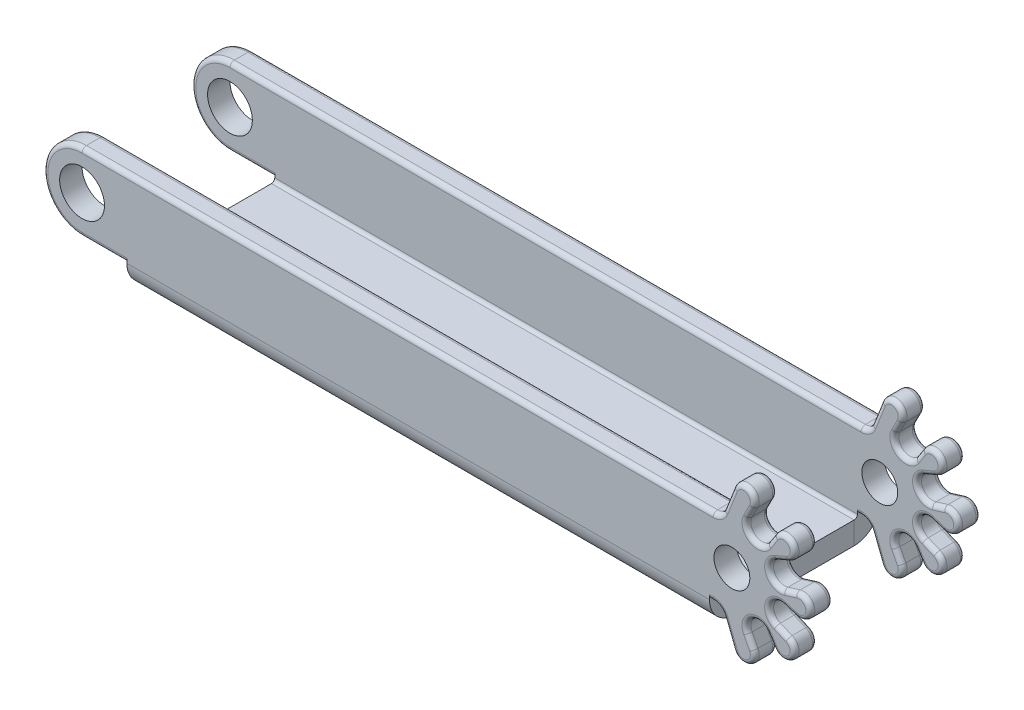
from build123d import *

# Parameters (mm, degrees)
SKETCH1_W                      = 130
SKETCH1_H                      = 38
BASE_FLANGE1_DEPTH             = 5
EDGE_FLANGE1_STRIP_W           = 21.4732
EDGE_FLANGE1_STRIP_H           = 5
EDGE_FLANGE1_STRIP_CUT_DEPTH   = 130
EDGE_FLANGE1_STRIP_2_W         = 21.4732
EDGE_FLANGE1_STRIP_2_H         = 5
EDGE_FLANGE1_STRIP_CUT_2_DEPTH = 130
EDGE_FLANGE1_DEPTH             = 130
EDGE_FLANGE1_BEND_DEPTH        = 130
SKETCH15_R                     = 5
BOSS_EXTRUDE1_DEPTH            = 5
BOSS_EXTRUDE2_DEPTH            = 5
SKETCH17_R                     = 4
CUT_EXTRUDE2_DEPTH             = 5
FILLET3_R                      = 2.5
FILLET4_R                      = 1


# Sheet-metal steps are written as plain solids
with BuildPart() as part:
    # Sketch1 → Base-Flange1 (new body)
    with BuildSketch(Plane(origin=(0, 0, 0), x_dir=(1, 0, 0), z_dir=(0, 1, 0))):
        Rectangle(SKETCH1_W, SKETCH1_H)
    extrude(amount=-BASE_FLANGE1_DEPTH)

    # Edge-Flange1 strip (across the edge) → Edge-Flange1 strip cut (cut)
    with BuildSketch(Plane(origin=(-65, 0, 19), x_dir=(0, 0, -1), z_dir=(1, 0, 0))):
        with Locations((-5, -2.5)):
            Rectangle(EDGE_FLANGE1_STRIP_W, EDGE_FLANGE1_STRIP_H)
    extrude(amount=EDGE_FLANGE1_STRIP_CUT_DEPTH, mode=Mode.SUBTRACT)

    # Edge-Flange1 strip 2 (across the edge) → Edge-Flange1 strip cut 2 (cut)
    with BuildSketch(Plane(origin=(65, 0, -19), x_dir=(0, 0, 1), z_dir=(-1, 0, 0))):
        with Locations((-5, -2.5)):
            Rectangle(EDGE_FLANGE1_STRIP_2_W, EDGE_FLANGE1_STRIP_2_H)
    extrude(amount=EDGE_FLANGE1_STRIP_CUT_2_DEPTH, mode=Mode.SUBTRACT)

    # Edge-Flange1 section (across the edge) → Edge-Flange1 (add)
    with BuildSketch(Plane(origin=(-65, 0, 19), x_dir=(0, 0, -1), z_dir=(1, 0, 0))):
        with BuildLine():
            Line((0, 0.7366), (0, 18))
            Line((0, 18), (5, 18))
            Line((5, 18), (5, 0.7366))
            ThreePointArc((5, 0.7366), (5.215745145, 0.215745145), (5.7366, 0))
            Line((5.7366, 0), (5.7366, -5))
            ThreePointArc((5.7366, -5), (1.680211239, -3.319788761), (0, 0.7366))
        make_face()
    extrude(amount=EDGE_FLANGE1_DEPTH)

    # Edge-Flange1 section 2 (across the edge) → Edge-Flange1 bend (add)
    with BuildSketch(Plane(origin=(65, 0, -19), x_dir=(0, 0, 1), z_dir=(-1, 0, 0))):
        with BuildLine():
            Line((0, 0.7366), (0, 18))
            Line((0, 18), (5, 18))
            Line((5, 18), (5, 0.7366))
            ThreePointArc((5, 0.7366), (5.215745145, 0.215745145), (5.7366, 0))
            Line((5.7366, 0), (5.7366, -5))
            ThreePointArc((5.7366, -5), (1.680211239, -3.319788761), (0, 0.7366))
        make_face()
    extrude(amount=EDGE_FLANGE1_BEND_DEPTH)

    # Sketch15 → Boss-Extrude1 (add)
    with BuildSketch(Plane.XY.offset(19)):
        with BuildLine():
            Line((-75, 18), (-65, 18))
            Line((-65, 18), (-65, 0.7366))
            Line((-65, 0.7366), (-75, 0.7366))
            ThreePointArc((-75, 0.7366), (-83.6317, 9.3683), (-75, 18))
        make_face()
        with Locations((-75, 9.3683)):
            Circle(SKETCH15_R, mode=Mode.SUBTRACT)
    boss_extrude1 = extrude(amount=-BOSS_EXTRUDE1_DEPTH)

    # Mirror3: Boss-Extrude1 across plane
    add(boss_extrude1.mirror(Plane.XY))

    # Sketch16 → Boss-Extrude2 (add)
    with BuildSketch(Plane.XY.offset(19)):
        with BuildLine():
            Line((65, 18), (67.5, 18))
            Line((67.5, 18), (70.278564416, 25.056379068))
            ThreePointArc((70.278564416, 25.056379068), (73.636399449, 26.417616992), (74.827213938, 22.995631363))
            Line((74.827213938, 22.995631363), (73.527508727, 20.472377076))
            ThreePointArc((73.527508727, 20.472377076), (74.5, 17.162528634), (77.85265847, 17.975250708))
            Line((77.85265847, 17.975250708), (79.388008177, 20.362455581))
            ThreePointArc((79.388008177, 20.362455581), (83.405777755, 20.61708317), (82.457340166, 16.704568156))
            Line((82.457340166, 16.704568156), (79.83979162, 15.607077637))
            ThreePointArc((79.83979162, 15.607077637), (78.457233587, 12.44648129), (81.547926657, 10.914015194))
            Line((81.547926657, 10.914015194), (84.258538482, 11.755816454))
            ThreePointArc((84.258538482, 11.755816454), (87.5, 9.3683), (84.258538482, 6.980783546))
            Line((84.258538482, 6.980783546), (81.547926657, 7.822584806))
            ThreePointArc((81.547926657, 7.822584806), (78.457233587, 6.29011871), (79.83979162, 3.129522363))
            Line((79.83979162, 3.129522363), (82.457340166, 2.032031844))
            ThreePointArc((82.457340166, 2.032031844), (83.405777755, -1.88048317), (79.388008177, -1.625855581))
            Line((79.388008177, -1.625855581), (77.85265847, 0.761349292))
            ThreePointArc((77.85265847, 0.761349292), (74.5, 1.574071366), (73.527508727, -1.735777076))
            Line((73.527508727, -1.735777076), (74.827213938, -4.259031363))
            ThreePointArc((74.827213938, -4.259031363), (73.636399449, -7.681016992), (70.278564416, -6.319779068))
            Line((70.278564416, -6.319779068), (67.5, 0.7366))
            Line((67.5, 0.7366), (65, 0.7366))
            Line((65, 0.7366), (65, 18))
        make_face()
    boss_extrude2 = extrude(amount=-BOSS_EXTRUDE2_DEPTH)

    # Sketch17 → Cut-Extrude2 (cut)
    with BuildSketch(Plane.XY.offset(19)):
        with Locations((70, 9.3683)):
            Circle(SKETCH17_R)
    cut_extrude2 = extrude(amount=-CUT_EXTRUDE2_DEPTH, mode=Mode.SUBTRACT)

    # Mirror5: Boss-Extrude2, Cut-Extrude2 across plane
    add(boss_extrude2.mirror(Plane.XY))
    add(cut_extrude2.mirror(Plane.XY), mode=Mode.SUBTRACT)

    # Fillet3
    fillet3_edges = [part.edges().sort_by_distance(p)[0] for p in [
        (67.5, 0.7366, 16.5),
        (67.5, 18, 16.5),
        (67.5, 18, -16.5),
        (67.5, 0.7366, -16.5),
    ]]
    fillet(fillet3_edges, radius=FILLET3_R)

    # Fillet4
    fillet4_edges = [part.edges().sort_by_distance(p)[0] for p in [
        (74.5, 1.574071366, 14),
        (74.177361333, -2.997404219, 14),
        (73.636399449, -7.681016992, 14),
        (65.39879113, 0.7366, 14),
        (69.201152463, 22.320208148, 14),
        (73.636399449, 26.417616992, 14),
        (74.177361333, 21.734004219, 14),
        (74.5, 17.162528634, 14),
        (78.620333323, 19.168853144, 14),
        (83.405777755, 20.61708317, 14),
        (81.148565893, 16.155822897, 14),
        (78.457233587, 12.44648129, 14),
        (82.90323257, 11.334915824, 14),
        (87.5, 9.3683, 14),
        (82.90323257, 7.401684176, 14),
        (78.457233587, 6.29011871, 14),
        (81.148565893, 2.580777103, 14),
        (83.405777755, -1.88048317, 14),
        (78.620333323, -0.432253144, 14),
        (74.5, 1.574071366, 19),
        (78.620333323, -0.432253144, 19),
        (83.405777755, -1.88048317, 19),
        (81.148565893, 2.580777103, 19),
        (78.457233587, 6.29011871, 19),
        (82.90323257, 7.401684176, 19),
        (87.5, 9.3683, 19),
        (82.90323257, 11.334915824, 19),
        (78.457233587, 12.44648129, 19),
        (81.148565893, 16.155822897, 19),
        (83.405777755, 20.61708317, 19),
        (78.620333323, 19.168853144, 19),
        (74.5, 17.162528634, 19),
        (74.177361333, 21.734004219, 19),
        (73.636399449, 26.417616992, 19),
        (69.201152463, 22.320208148, 19),
        (65.39879113, 0.7366, 19),
        (73.636399449, -7.681016992, 19),
        (74.177361333, -2.997404219, 19),
        (74.5, 1.574071366, -19),
        (78.620333323, -0.432253144, -19),
        (83.405777755, -1.88048317, -19),
        (81.148565893, 2.580777103, -19),
        (78.457233587, 6.29011871, -19),
        (82.90323257, 7.401684176, -19),
        (87.5, 9.3683, -19),
        (82.90323257, 11.334915824, -19),
        (78.457233587, 12.44648129, -19),
        (81.148565893, 16.155822897, -19),
        (83.405777755, 20.61708317, -19),
        (78.620333323, 19.168853144, -19),
        (74.5, 17.162528634, -19),
        (74.177361333, 21.734004219, -19),
        (73.636399449, 26.417616992, -19),
        (69.201152463, 22.320208148, -19),
        (65.39879113, 0.7366, -19),
        (73.636399449, -7.681016992, -19),
        (74.177361333, -2.997404219, -19),
        (74.5, 1.574071366, -14),
        (78.620333323, -0.432253144, -14),
        (83.405777755, -1.88048317, -14),
        (81.148565893, 2.580777103, -14),
        (78.457233587, 6.29011871, -14),
        (82.90323257, 7.401684176, -14),
        (87.5, 9.3683, -14),
        (82.90323257, 11.334915824, -14),
        (78.457233587, 12.44648129, -14),
        (81.148565893, 16.155822897, -14),
        (83.405777755, 20.61708317, -14),
        (78.620333323, 19.168853144, -14),
        (74.5, 17.162528634, -14),
        (74.177361333, 21.734004219, -14),
        (73.636399449, 26.417616992, -14),
        (69.201152463, 22.320208148, -14),
        (65.39879113, 0.7366, -14),
        (73.636399449, -7.681016992, -14),
        (74.177361333, -2.997404219, -14),
        (69.201152463, -3.583608148, -19),
        (69.201152463, -3.583608148, -14),
        (69.201152463, -3.583608148, 19),
        (69.201152463, -3.583608148, 14),
        (-4.60120887, 18, 14),
        (-4.60120887, 18, 19),
        (67.204723523, 0.302986572, -19),
        (67.204723523, 0.302986572, -14),
        (67.204723523, 0.302986572, 19),
        (67.204723523, 0.302986572, 14),
        (67.204723523, 18.433613428, -19),
        (67.204723523, 18.433613428, -14),
        (67.204723523, 18.433613428, 19),
        (67.204723523, 18.433613428, 14),
        (-4.60120887, 18, -19),
        (-4.60120887, 18, -14),
        (-70, 0.7366, 14),
        (-83.6317, 9.3683, 14),
        (-70, 0.7366, 19),
        (-83.6317, 9.3683, 19),
        (-70, 0.7366, -14),
        (-83.6317, 9.3683, -14),
        (-70, 0.7366, -19),
        (-83.6317, 9.3683, -19),
    ]]
    fillet(fillet4_edges, radius=FILLET4_R)


solid = part.part
